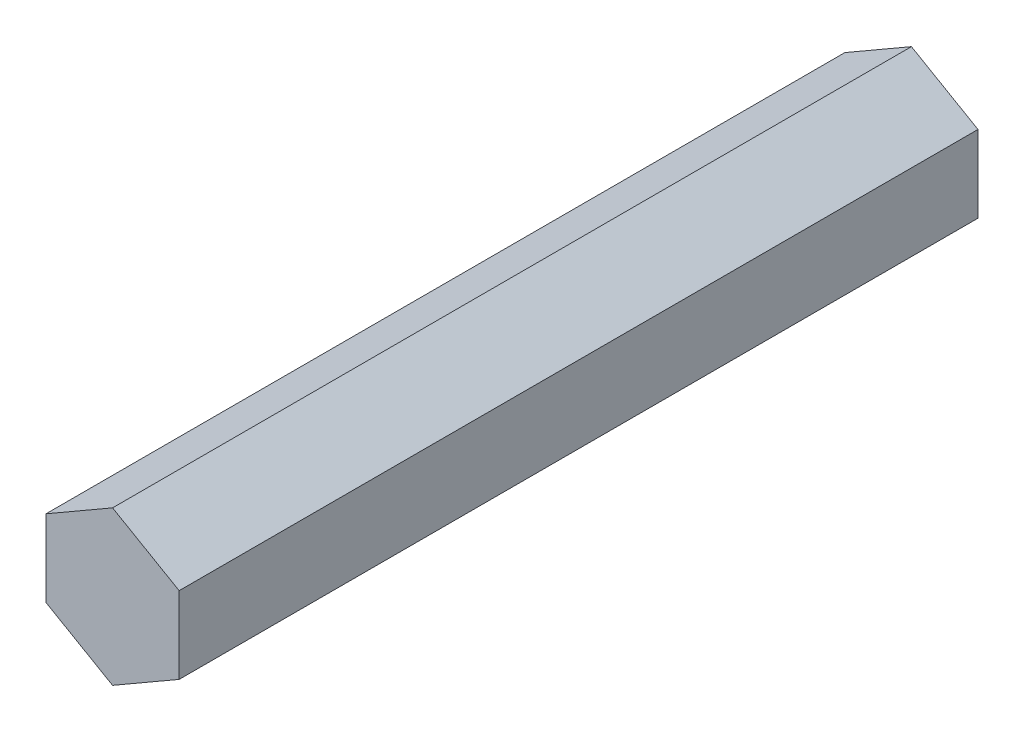
from build123d import *

# Parameters (mm, degrees)
ESTRUSIONE_ESTRUSIONE1_DEPTH = 30


with BuildPart() as part:
    # Schizzo1 → Estrusione-Estrusione1 (new body)
    with BuildSketch(Plane.XY):
        Polygon((0, -16.964772049), (-2.5, -18.408147722), (-2.5, -21.294899068), (0, -22.738274741), (2.5, -21.294899068), (2.5, -18.408147722), align=None)
    extrude(amount=ESTRUSIONE_ESTRUSIONE1_DEPTH)


solid = part.part
